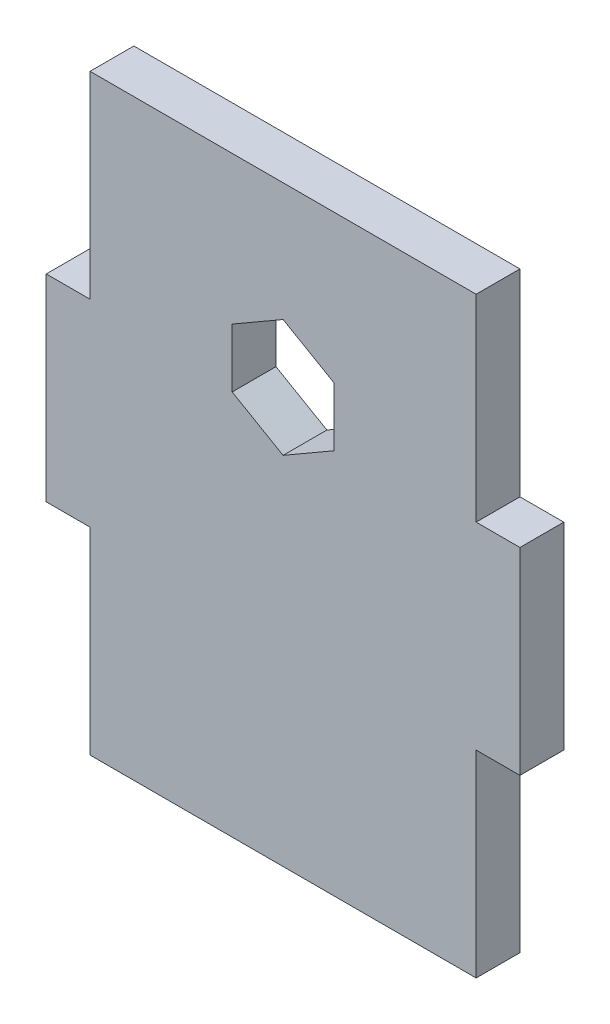
from build123d import *

# Parameters (mm, degrees)
BOSS_EXTRUDE1_DEPTH = 4.699
SKETCH2_R           = 3.175
CUT_EXTRUDE1_DEPTH  = 79.610640514
CAVITY1_OUTLINE_R   = 3.175
CAVITY1_DEPTH       = 4.699


# Read off the part's stored shape, not the designer's step: Cavity1
with BuildPart() as part:
    # Sketch1 → Boss-Extrude1 (new body)
    with BuildSketch(Plane.XY):
        Polygon((0, 42.333333333), (0, 63.5), (41.402, 63.5), (41.402, 42.333333333), (46.101, 42.333333333), (46.101, 21.166666667), (41.402, 21.166666667), (41.402, 0), (0, 0), (0, 21.166666667), (-4.699, 21.166666667), (-4.699, 42.333333333), align=None)
    extrude(amount=BOSS_EXTRUDE1_DEPTH)

    # Sketch2 → Cut-Extrude1 (cut, through all)
    with BuildSketch(Plane(origin=(0, 0, 0), x_dir=(-1, 0, 0), z_dir=(0, 0, -1))):
        with Locations((-20.701, 44.45)):
            Circle(SKETCH2_R)
    extrude(amount=-CUT_EXTRUDE1_DEPTH, mode=Mode.SUBTRACT)

    # Cavity1 outline → Cavity1 (cut)
    with BuildSketch(Plane.XY):
        Polygon((15.24, 41.34127054), (20.701, 38.18836072), (26.162, 41.34127054), (26.162, 47.64709018), (20.701, 50.8), (15.24, 47.64709018), align=None)
        with Locations((20.701, 44.45)):
            Circle(CAVITY1_OUTLINE_R, mode=Mode.SUBTRACT)
    extrude(amount=CAVITY1_DEPTH, mode=Mode.SUBTRACT)


solid = part.part
